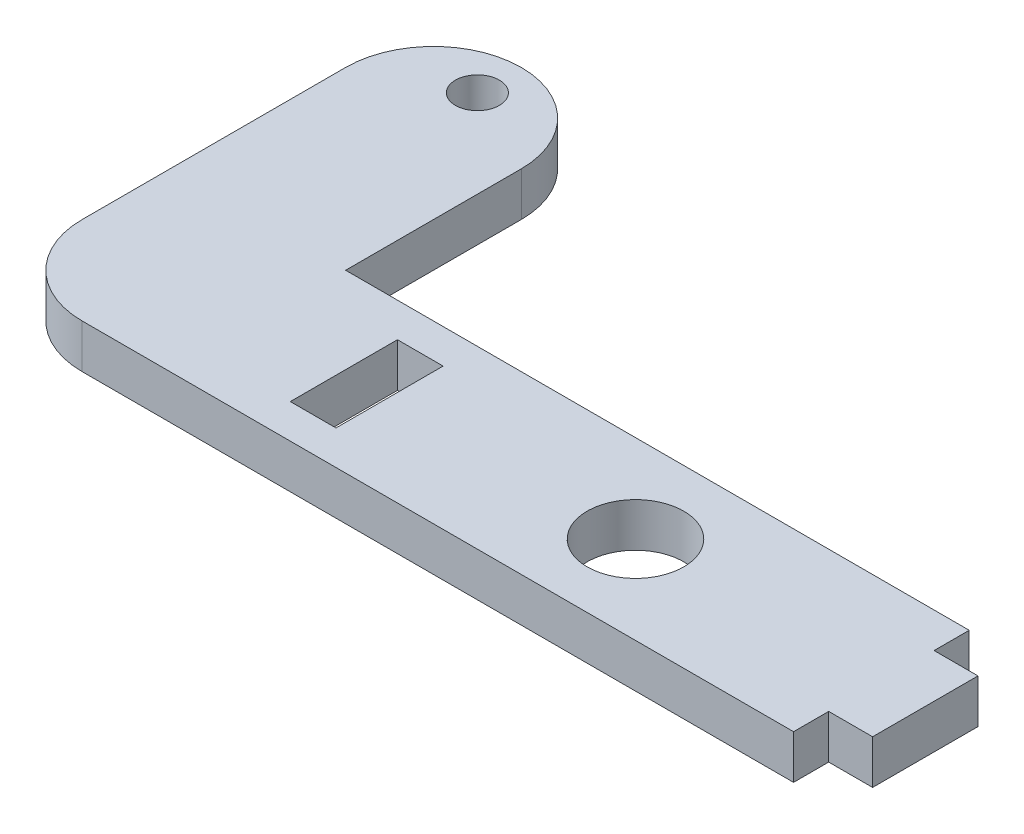
from build123d import *

# Parameters (mm, degrees)
HEX_START                = 11.30066774
HEX_OUTER_SIDE_OUTLINE_W = 3.302
HEX_OUTER_SIDE_OUTLINE_H = 7.747
HEX_OUTER_SIDE_OUTLINE_R = 1.5875
HEX_OUTER_SIDE_DEPTH     = 3.175
SKETCH1_R                = 3.4925
CUT_EXTRUDE1_DEPTH       = 3.175


# Read off the part's stored shape, not the designer's step: Hex Outer Side
with BuildPart() as part:
    # Hex Outer Side outline → Hex Outer Side (new body)
    with BuildSketch(Plane(origin=(0, 0, 0), x_dir=(1, 0, 0), z_dir=(0, 1, 0)).offset(HEX_START)):
        with BuildLine():
            Line((-47.528050259, 17.731483109), (-47.528050259, -1.318516891))
            ThreePointArc((-47.528050259, -1.318516891), (-45.66817832, -5.808644951), (-41.178050259, -7.668516891))
            Line((-41.178050259, -7.668516891), (10.256949741, -7.668516891))
            Line((10.256949741, -7.668516891), (10.256949741, -5.128516891))
            Line((10.256949741, -5.128516891), (13.431949741, -5.128516891))
            Line((13.431949741, -5.128516891), (13.431949741, 2.491483109))
            Line((13.431949741, 2.491483109), (10.256949741, 2.491483109))
            Line((10.256949741, 2.491483109), (10.256949741, 5.031483109))
            Line((10.256949741, 5.031483109), (-34.828050259, 5.031483109))
            Line((-34.828050259, 5.031483109), (-34.828050259, 17.731483109))
            ThreePointArc((-34.828050259, 17.731483109), (-36.687922199, 22.22161117), (-41.178050259, 24.081483109))
            ThreePointArc((-41.178050259, 24.081483109), (-45.668178319, 22.221611169), (-47.528050259, 17.731483109))
        make_face()
        with Locations((-26.954050259, -1.318516891)):
            Rectangle(HEX_OUTER_SIDE_OUTLINE_W, HEX_OUTER_SIDE_OUTLINE_H, mode=Mode.SUBTRACT)
        with Locations((-41.178050259, 20.906483109)):
            Circle(HEX_OUTER_SIDE_OUTLINE_R, mode=Mode.SUBTRACT)
    extrude(amount=HEX_OUTER_SIDE_DEPTH)

    # Sketch1 → Cut-Extrude1 (cut)
    with BuildSketch(Plane(origin=(0, 14.47566774, 0), x_dir=(1, 0, 0), z_dir=(0, 1, 0))):
        with Locations(Location((-7.523050259, -1.318516891, 0), (0, 0, 270))):
            Circle(SKETCH1_R)
    extrude(amount=-CUT_EXTRUDE1_DEPTH, mode=Mode.SUBTRACT)


solid = part.part
